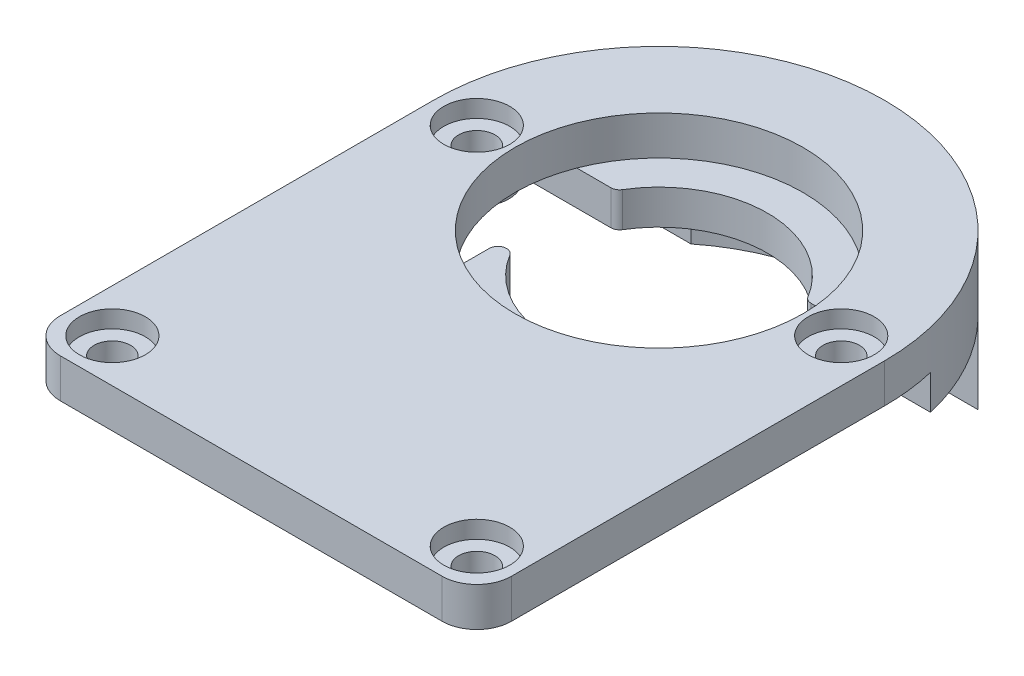
from build123d import *

# Parameters (mm, degrees)
SKETCH_1_R                   = 8.3
EXTRUDE_1_DEPTH              = 2.25
EXTRUDE_START                = 2
EXTRUDE_2_DEPTH              = 2
EXTRUDE_START_2              = 4.5
EXTRUDE_3_DEPTH              = 4.5
EXTRUDE_4_DEPTH              = 2
FILLET_1_R                   = 0.5
SKETCH_5_R                   = 1.85
EXTRUDE_5_DEPTH              = 0.5
HOLE_WIZARD_M2_1_D           = 2.1
HOLE_WIZARD_M2_1_CBORE_D     = 3.8
HOLE_WIZARD_M2_1_CBORE_DEPTH = 1
FILLET_2_R                   = 2


with BuildPart() as part:
    # ｽｹｯﾁ1 → ﾎﾞｽ - 押し出し1 (new body)
    with BuildSketch(Plane(origin=(0, 0, 0), x_dir=(1, 0, 0), z_dir=(0, 1, 0))):
        with BuildLine():
            ThreePointArc((13, 10.5), (0, 23.5), (-13, 10.5))
            Line((-13, 10.5), (-13, -13))
            Line((-13, -13), (13, -13))
            Line((13, -13), (13, 10.5))
        make_face()
        with Locations(Location((0, 10.5, 0), (0, 0, 270))):
            Circle(SKETCH_1_R, mode=Mode.SUBTRACT)
    extrude(amount=EXTRUDE_1_DEPTH)

    # ｽｹｯﾁ2 → ﾎﾞｽ - 押し出し2 (add)
    with BuildSketch(Plane.XZ.offset(EXTRUDE_START)):
        with BuildLine():
            Line((-12.649110641, -13.5), (-5.48292805, -13.5))
            ThreePointArc((-5.48292805, -13.5), (0, -16.75), (5.48292805, -13.5))
            Line((5.48292805, -13.5), (12.649110641, -13.5))
            ThreePointArc((12.649110641, -13.5), (0, -23.5), (-12.649110641, -13.5))
        make_face()
    extrude(amount=-EXTRUDE_2_DEPTH)

    # ｽｹｯﾁ3 → ﾎﾞｽ - 押し出し3 (add)
    with BuildSketch(Plane.XZ.offset(2).offset(EXTRUDE_START_2)):
        with BuildLine():
            Line((-9.38083152, -19.5), (-7.158910532, -19.5))
            ThreePointArc((-7.158910532, -19.5), (0, -22), (7.158910532, -19.5))
            Line((7.158910532, -19.5), (9.38083152, -19.5))
            ThreePointArc((9.38083152, -19.5), (0, -23.5), (-9.38083152, -19.5))
        make_face()
    extrude(amount=-EXTRUDE_3_DEPTH)

    # ｽｹｯﾁ4 → ﾎﾞｽ - 押し出し4 (add)
    with BuildSketch(Plane.XZ.offset(EXTRUDE_START)):
        with BuildLine():
            Line((-6.25, 6.25), (6.25, 6.25))
            Line((6.25, 6.25), (6.25, -10.5))
            ThreePointArc((6.25, -10.5), (0, -4.25), (-6.25, -10.5))
            Line((-6.25, -10.5), (-6.25, 6.25))
        make_face()
    extrude(amount=-EXTRUDE_4_DEPTH)

    # ﾌｨﾚｯﾄ1
    # the kernel refuses this fillet: 0.5 mm, written as the material it takes off along each edge
    with BuildSketch(Plane(origin=(5.48292805, -2.721925351, -13.5), x_dir=(1, 0, 0), z_dir=(0, 1, 0))) as fillet_1_piece_1:
        with BuildLine():
            CenterArc((0.28877014, 0.5), FILLET_1_R, 211.232929016, 58.767070984)
            ThreePointArc((-0.138763059, 0.240740741), (-0.068043475, 0.121141625), (0, 0))
            Line((0, 0), (0.28877014, 0))
        make_face()
    extrude(amount=3.443850702, mode=Mode.SUBTRACT)
    with BuildSketch(Plane(origin=(-5.48292805, -2.721925351, -13.5), x_dir=(-1, 0, 0), z_dir=(0, 1, 0))) as fillet_1_piece_2:
        with BuildLine():
            CenterArc((0.28877014, -0.5), FILLET_1_R, 90, 58.767070984)
            ThreePointArc((-0.138763059, -0.240740741), (-0.068043475, -0.121141625), (0, 0))
            Line((0, 0), (0.28877014, 0))
        make_face()
    extrude(amount=3.443850702, mode=Mode.SUBTRACT)
    with BuildSketch(Plane(origin=(-6.25, -10.838834765, -10.5), x_dir=(0, 0, 1), z_dir=(0, 1, 0))) as fillet_1_piece_3:
        with BuildLine():
            CenterArc((3.535533906, 0.5), FILLET_1_R, 121.586338097, 148.413661903)
            ThreePointArc((3.273642506, 0.925925926), (1.701034544, 0.235934696), (0, 0))
            Line((0, 0), (3.535533906, 0))
        make_face()
    extrude(amount=19.67766953, mode=Mode.SUBTRACT)
    with BuildSketch(Plane(origin=(6.25, -10.838834765, -10.5), x_dir=(0, 0, 1), z_dir=(0, 1, 0))) as fillet_1_piece_4:
        with BuildLine():
            CenterArc((3.535533906, -0.5), FILLET_1_R, 90, 148.413661903)
            ThreePointArc((3.273642506, -0.925925926), (1.701034544, -0.235934696), (0, 0))
            Line((0, 0), (3.535533906, 0))
        make_face()
    extrude(amount=19.67766953, mode=Mode.SUBTRACT)

    # ｽｹｯﾁ5 → ﾎﾞｽ - 押し出し5 (add)
    with BuildSketch(Plane.XZ):
        with Locations(Location((-10.5, 10.5, 0), (0, 0, 90))):
            Circle(SKETCH_5_R)
        with Locations(Location((10.5, 10.5, 0), (0, 0, 90))):
            Circle(SKETCH_5_R)
        with Locations(Location((-10.5, -10.5, 0), (0, 0, 90))):
            Circle(SKETCH_5_R)
        with Locations(Location((10.5, -10.5, 0), (0, 0, 90))):
            Circle(SKETCH_5_R)
    extrude(amount=EXTRUDE_5_DEPTH)

    # M2 丸平ねじ用座ぐり穴1 (through all)
    with Locations(Plane(origin=(0, 2.25, 0), x_dir=(1, 0, 0), z_dir=(0, 1, 0))):
        with Locations((10.5, 10.5), (-10.5, 10.5), (-10.5, -10.5), (10.5, -10.5)):
            CounterBoreHole(HOLE_WIZARD_M2_1_D / 2, HOLE_WIZARD_M2_1_CBORE_D / 2, HOLE_WIZARD_M2_1_CBORE_DEPTH)

    # ﾌｨﾚｯﾄ2
    fillet_2_edges = [part.edges().sort_by_distance(p)[0] for p in [
        (13, 1.125, 13),
        (-13, 1.125, 13),
    ]]
    fillet(fillet_2_edges, radius=FILLET_2_R)


solid = part.part
